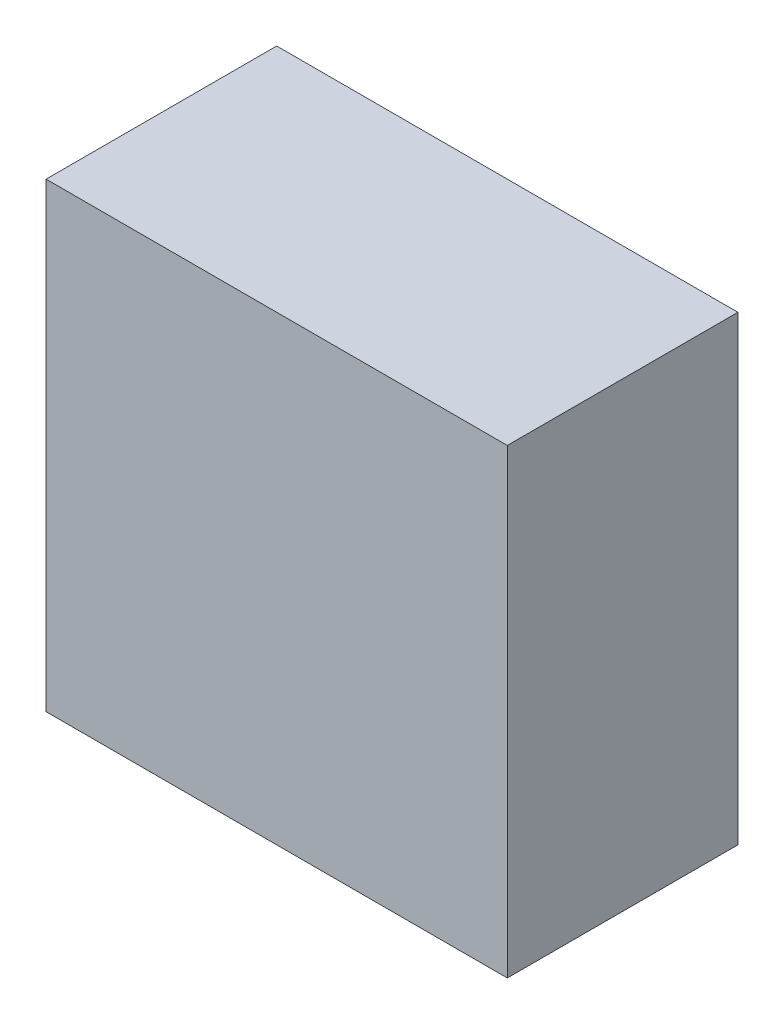
from build123d import *

# Parameters (mm, degrees)
SKETCH1_W           = 160
SKETCH1_H           = 160
BOSS_EXTRUDE1_DEPTH = 80


with BuildPart() as part:
    # Sketch1 → Boss-Extrude1 (new body)
    with BuildSketch(Plane.XY):
        with Locations((80, 80)):
            Rectangle(SKETCH1_W, SKETCH1_H)
    extrude(amount=BOSS_EXTRUDE1_DEPTH)


solid = part.part
